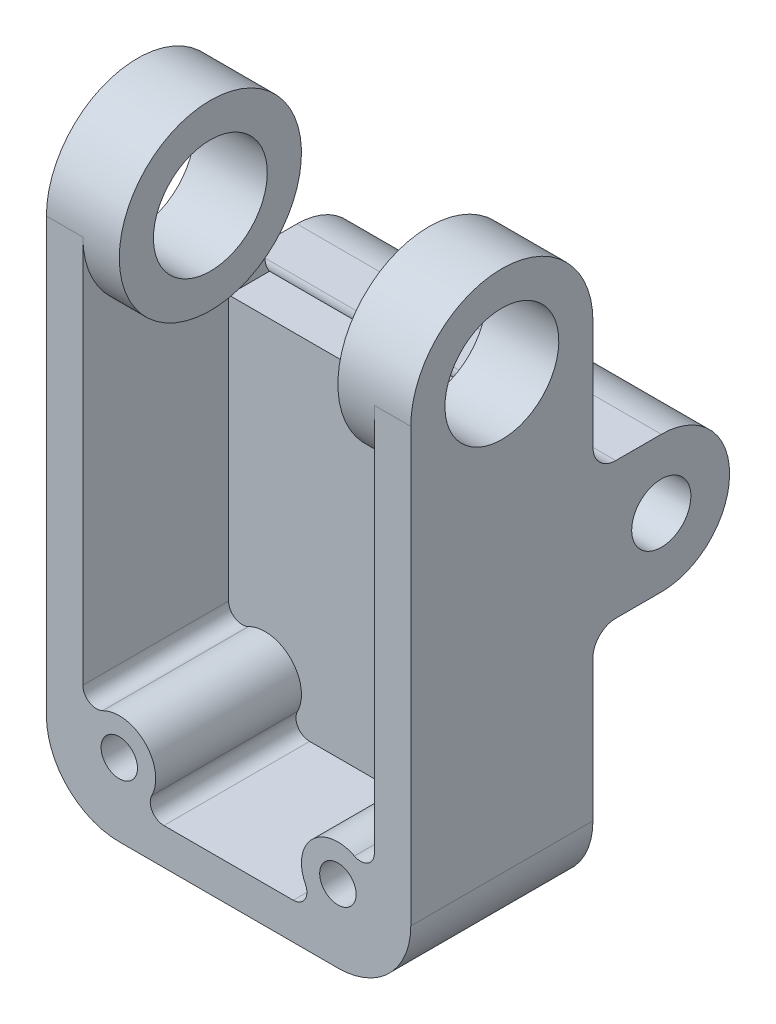
from build123d import *

# Parameters (mm, degrees)
SKETCH1_W           = 84
SKETCH1_H           = 80
BOSS_EXTRUDE1_DEPTH = 8
SKETCH2_R           = 12.5
BOSS_EXTRUDE3_DEPTH = 8
FILLET1_R           = 16
SKETCH3_R           = 4
BOSS_EXTRUDE4_DEPTH = 40
SKETCH4_R           = 20
SKETCH4_R_2         = 12.5
BOSS_EXTRUDE5_DEPTH = 8
SKETCH5_R           = 6.5
BOSS_EXTRUDE6_DEPTH = 80
FILLET2_R           = 5
SKETCH6_R           = 16
SKETCH6_R_2         = 5
BOSS_EXTRUDE7_DEPTH = 8


with BuildPart() as part:
    # Sketch1 → Boss-Extrude1 (new body)
    with BuildSketch(Plane(origin=(0, 0, 0), x_dir=(0, 1, 0), z_dir=(0, 0, 1))):
        with Locations((42, 0)):
            Rectangle(SKETCH1_W, SKETCH1_H)
    extrude(amount=BOSS_EXTRUDE1_DEPTH)

    # Sketch2 → Boss-Extrude3 (add)
    with BuildSketch(Plane.YZ.offset(40)):
        with BuildLine():
            Line((0, 0), (0, 40))
            Line((0, 40), (111, 40))
            ThreePointArc((111, 40), (131, 20), (111, 0))
            Line((111, 0), (0, 0))
        make_face()
        with Locations((111, 20)):
            Circle(SKETCH2_R, mode=Mode.SUBTRACT)
    boss_extrude3 = extrude(amount=-BOSS_EXTRUDE3_DEPTH)

    # Mirror1: Boss-Extrude3 across plane
    add(boss_extrude3.mirror(Plane(origin=(0, 0, 0), x_dir=(0, 0, 1), z_dir=(1, 0, 0))))

    # Fillet1
    fillet1_edges = [part.edges().sort_by_distance(p)[0] for p in [
        (-40, 0, 20),
        (40, 0, 20),
    ]]
    fillet(fillet1_edges, radius=FILLET1_R)

    # Sketch3 → Boss-Extrude4 (add)
    with BuildSketch(Plane(origin=(0, 0, 0), x_dir=(0, 1, 0), z_dir=(0, 0, 1))):
        with BuildLine():
            Line((8, 14.202041029), (8, -14.202041029))
            ThreePointArc((8, -14.202041029), (9.433301096, -16.760449625), (12.363636364, -16.874211657))
            ThreePointArc((12.363636364, -16.874211657), (21.656854249, -18.343145751), (23.125788343, -27.636363636))
            ThreePointArc((23.125788343, -27.636363636), (23.239550375, -30.566698904), (25.797958971, -32))
            Line((25.797958971, -32), (84, -32))
            Line((84, -32), (84, -40))
            Line((84, -40), (16, -40))
            ThreePointArc((16, -40), (4.686291501, -35.313708499), (0, -24))
            Line((0, -24), (0, 24))
            ThreePointArc((0, 24), (4.686291501, 35.313708499), (16, 40))
            Line((16, 40), (84, 40))
            Line((84, 40), (84, 32))
            Line((84, 32), (25.797958971, 32))
            ThreePointArc((25.797958971, 32), (23.239550375, 30.566698904), (23.125788343, 27.636363636))
            ThreePointArc((23.125788343, 27.636363636), (21.656854249, 18.343145751), (12.363636364, 16.874211657))
            ThreePointArc((12.363636364, 16.874211657), (9.433301096, 16.760449625), (8, 14.202041029))
        make_face()
        with Locations(Location((16, 24, 0), (0, 0, 90))):
            Circle(SKETCH3_R, mode=Mode.SUBTRACT)
        with Locations(Location((16, -24, 0), (0, 0, 90))):
            Circle(SKETCH3_R, mode=Mode.SUBTRACT)
    extrude(amount=BOSS_EXTRUDE4_DEPTH)

    # Sketch4 → Boss-Extrude5 (add)
    with BuildSketch(Plane.YZ.offset(-32)):
        with Locations(Location((111, 20, 0), (0, 0, 90))):
            Circle(SKETCH4_R)
        with Locations((111, 20)):
            Circle(SKETCH4_R_2, mode=Mode.SUBTRACT)
    boss_extrude5 = extrude(amount=BOSS_EXTRUDE5_DEPTH)

    # Mirror2: Boss-Extrude5 across plane
    add(boss_extrude5.mirror(Plane(origin=(0, 0, 0), x_dir=(0, 0, 1), z_dir=(1, 0, 0))))

    # Sketch5 → Boss-Extrude6 (add)
    with BuildSketch(Plane.YZ.offset(40)):
        with BuildLine():
            Line((52, -15), (52, 0))
            Line((52, 0), (82, 0))
            Line((82, 0), (82, -15))
            ThreePointArc((82, -15), (67, -30), (52, -15))
        make_face()
        with Locations((67, -15)):
            Circle(SKETCH5_R, mode=Mode.SUBTRACT)
    extrude(amount=-BOSS_EXTRUDE6_DEPTH)

    # Fillet2
    # the kernel refuses this fillet: 5 mm, written as the material it adds along each edge
    with BuildSketch(Plane(origin=(40, 82, 0), x_dir=(0, 1, 0), z_dir=(-1, 0, 0))) as fillet2_piece_1_section:
        with BuildLine():
            CenterArc((FILLET2_R, FILLET2_R), FILLET2_R, 180, 90)
            Line((0, FILLET2_R), (0, 0))
            Line((0, 0), (FILLET2_R, 0))
        make_face()
    fillet2_piece_1 = extrude(amount=80, mode=Mode.PRIVATE)
    fillet2_piece_1 = split(fillet2_piece_1, bisect_by=Plane(origin=(32, 84.91705828, -0.211887472), z_dir=(1, 0, 0)), keep=Keep.TOP, mode=Mode.PRIVATE)
    fillet2_piece_1 = split(fillet2_piece_1, bisect_by=Plane(origin=(36, 84, -0.211887472), z_dir=(0, 1, 0)), keep=Keep.TOP, mode=Mode.PRIVATE)
    add(fillet2_piece_1)
    with BuildSketch(Plane(origin=(40, 82, 0), x_dir=(0, 1, 0), z_dir=(-1, 0, 0))) as fillet2_piece_2_section:
        with BuildLine():
            CenterArc((FILLET2_R, FILLET2_R), FILLET2_R, 180, 90)
            Line((0, FILLET2_R), (0, 0))
            Line((0, 0), (FILLET2_R, 0))
        make_face()
    fillet2_piece_2 = extrude(amount=80, mode=Mode.PRIVATE)
    fillet2_piece_2 = split(fillet2_piece_2, bisect_by=Plane(origin=(32, 82.693888299, -1.35777961), z_dir=(1, 0, 0)), keep=Keep.TOP, mode=Mode.PRIVATE)
    fillet2_piece_2 = split(fillet2_piece_2, bisect_by=Plane(origin=(36, 84, -1.35777961), z_dir=(0, -1, 0)), keep=Keep.TOP, mode=Mode.PRIVATE)
    add(fillet2_piece_2)
    with BuildSketch(Plane(origin=(40, 82, 0), x_dir=(0, 1, 0), z_dir=(-1, 0, 0))) as fillet2_piece_3_section:
        with BuildLine():
            CenterArc((FILLET2_R, FILLET2_R), FILLET2_R, 180, 90)
            Line((0, FILLET2_R), (0, 0))
            Line((0, 0), (FILLET2_R, 0))
        make_face()
    fillet2_piece_3 = extrude(amount=80, mode=Mode.PRIVATE)
    fillet2_piece_3 = split(fillet2_piece_3, bisect_by=Plane(origin=(32, 82.693888299, -1.35777961), z_dir=(-1, 0, 0)), keep=Keep.TOP, mode=Mode.PRIVATE)
    fillet2_piece_3 = split(fillet2_piece_3, bisect_by=Plane(origin=(-32, 82.693888299, -1.35777961), z_dir=(1, 0, 0)), keep=Keep.TOP, mode=Mode.PRIVATE)
    fillet2_piece_3 = split(fillet2_piece_3, bisect_by=Plane(origin=(0, 84, -1.35777961), z_dir=(0, -1, 0)), keep=Keep.TOP, mode=Mode.PRIVATE)
    add(fillet2_piece_3)
    with BuildSketch(Plane(origin=(40, 82, 0), x_dir=(0, 1, 0), z_dir=(-1, 0, 0))) as fillet2_piece_4_section:
        with BuildLine():
            CenterArc((FILLET2_R, FILLET2_R), FILLET2_R, 180, 90)
            Line((0, FILLET2_R), (0, 0))
            Line((0, 0), (FILLET2_R, 0))
        make_face()
    fillet2_piece_4 = extrude(amount=80, mode=Mode.PRIVATE)
    fillet2_piece_4 = split(fillet2_piece_4, bisect_by=Plane(origin=(-32, 84.91705828, -0.211887472), z_dir=(-1, 0, 0)), keep=Keep.TOP, mode=Mode.PRIVATE)
    fillet2_piece_4 = split(fillet2_piece_4, bisect_by=Plane(origin=(-36, 84, -0.211887472), z_dir=(0, 1, 0)), keep=Keep.TOP, mode=Mode.PRIVATE)
    add(fillet2_piece_4)
    with BuildSketch(Plane(origin=(40, 82, 0), x_dir=(0, 1, 0), z_dir=(-1, 0, 0))) as fillet2_piece_5_section:
        with BuildLine():
            CenterArc((FILLET2_R, FILLET2_R), FILLET2_R, 180, 90)
            Line((0, FILLET2_R), (0, 0))
            Line((0, 0), (FILLET2_R, 0))
        make_face()
    fillet2_piece_5 = extrude(amount=80, mode=Mode.PRIVATE)
    fillet2_piece_5 = split(fillet2_piece_5, bisect_by=Plane(origin=(-32, 82.693888299, -1.35777961), z_dir=(-1, 0, 0)), keep=Keep.TOP, mode=Mode.PRIVATE)
    fillet2_piece_5 = split(fillet2_piece_5, bisect_by=Plane(origin=(-36, 84, -1.35777961), z_dir=(0, -1, 0)), keep=Keep.TOP, mode=Mode.PRIVATE)
    add(fillet2_piece_5)
    with BuildSketch(Plane(origin=(40, 52, 0), x_dir=(0, -1, 0), z_dir=(-1, 0, 0))) as fillet2_piece_6:
        with BuildLine():
            CenterArc((FILLET2_R, -FILLET2_R), FILLET2_R, 90, 90)
            Line((0, -FILLET2_R), (0, 0))
            Line((0, 0), (FILLET2_R, 0))
        make_face()
    extrude(amount=80)

    # Sketch6 → Boss-Extrude7 (add)
    with BuildSketch(Plane.XZ):
        with Locations(Location((0, 16, 0), (0, 0, 270))):
            Circle(SKETCH6_R)
        with Locations((0, 16)):
            Circle(SKETCH6_R_2, mode=Mode.SUBTRACT)
    extrude(amount=BOSS_EXTRUDE7_DEPTH)


solid = part.part
